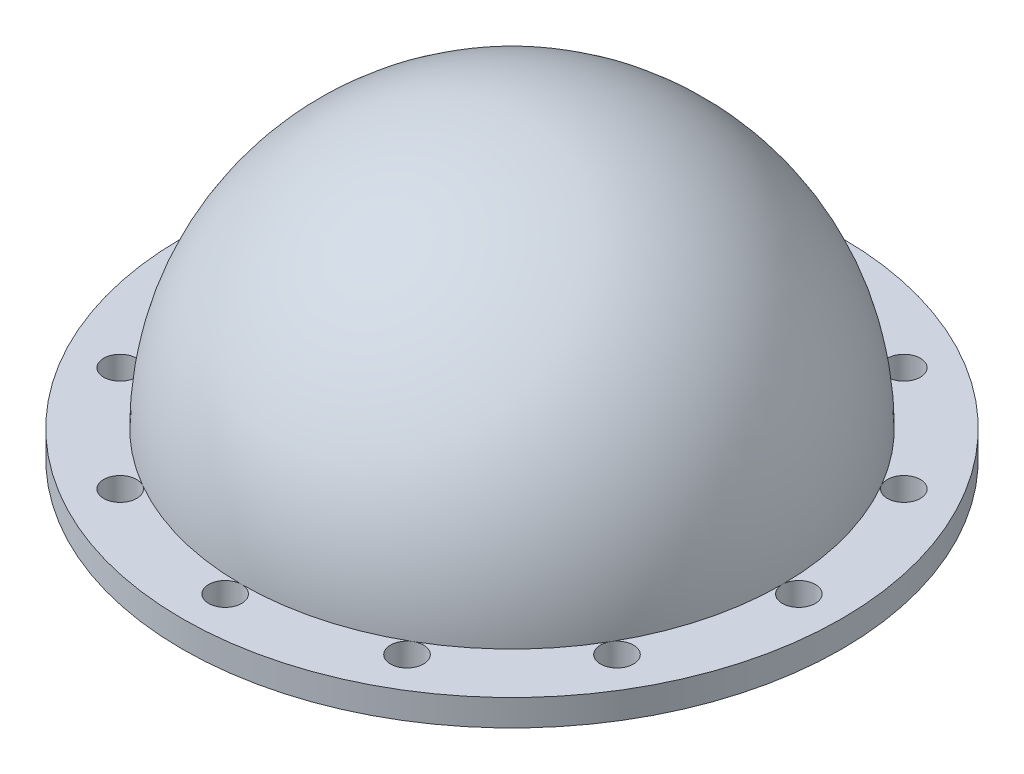
from build123d import *

# Parameters (mm, degrees)
SKETCH1_R           = 250
SKETCH1_R_2         = 180
SKETCH1_R_3         = 12.5
BOSS_EXTRUDE1_DEPTH = 20


# Read off the part's stored shape, not the designer's step: Revolve1
with BuildPart() as part:
    # Sketch1 → Boss-Extrude1 (new body)
    with BuildSketch(Plane(origin=(0, 0, 0), x_dir=(1, 0, 0), z_dir=(0, 1, 0))):
        with Locations(Location((0, 0, 0), (0, 0, 270))):
            Circle(SKETCH1_R)
        with Locations(Location((0, 0, 0), (0, 0, 270))):
            Circle(SKETCH1_R_2, mode=Mode.SUBTRACT)
        with Locations(Location((0, 217.5, 0), (0, 0, 270))):
            Circle(SKETCH1_R_3, mode=Mode.SUBTRACT)
        with Locations(Location((108.75, 188.360525323, 0), (0, 0, 270))):
            Circle(SKETCH1_R_3, mode=Mode.SUBTRACT)
        with Locations(Location((188.360525323, 108.75, 0), (0, 0, 270))):
            Circle(SKETCH1_R_3, mode=Mode.SUBTRACT)
        with Locations(Location((217.5, 0, 0), (0, 0, 270))):
            Circle(SKETCH1_R_3, mode=Mode.SUBTRACT)
        with Locations(Location((188.360525323, -108.75, 0), (0, 0, 270))):
            Circle(SKETCH1_R_3, mode=Mode.SUBTRACT)
        with Locations(Location((108.75, -188.360525323, 0), (0, 0, 270))):
            Circle(SKETCH1_R_3, mode=Mode.SUBTRACT)
        with Locations(Location((0, -217.5, 0), (0, 0, 270))):
            Circle(SKETCH1_R_3, mode=Mode.SUBTRACT)
        with Locations(Location((-108.75, -188.360525323, 0), (0, 0, 270))):
            Circle(SKETCH1_R_3, mode=Mode.SUBTRACT)
        with Locations(Location((-188.360525323, -108.75, 0), (0, 0, 270))):
            Circle(SKETCH1_R_3, mode=Mode.SUBTRACT)
        with Locations(Location((-217.5, 0, 0), (0, 0, 270))):
            Circle(SKETCH1_R_3, mode=Mode.SUBTRACT)
        with Locations(Location((-188.360525323, 108.75, 0), (0, 0, 270))):
            Circle(SKETCH1_R_3, mode=Mode.SUBTRACT)
        with Locations(Location((-108.75, 188.360525323, 0), (0, 0, 270))):
            Circle(SKETCH1_R_3, mode=Mode.SUBTRACT)
    extrude(amount=BOSS_EXTRUDE1_DEPTH)

    # Revolve1 outline → Revolve1 (revolve)
    with BuildSketch(Plane.XY):
        with BuildLine():
            ThreePointArc((205, 19.9999999), (144.956890179, 164.956890108), (0, 225))
            Line((0, 225), (0, 200))
            ThreePointArc((0, 200), (127.279220649, 147.279220578), (180, 19.9999999))
            Line((180, 19.9999999), (205, 19.9999999))
        make_face()
    revolve(axis=Axis((0, 0, 0), (0, 1, 0)))


solid = part.part
